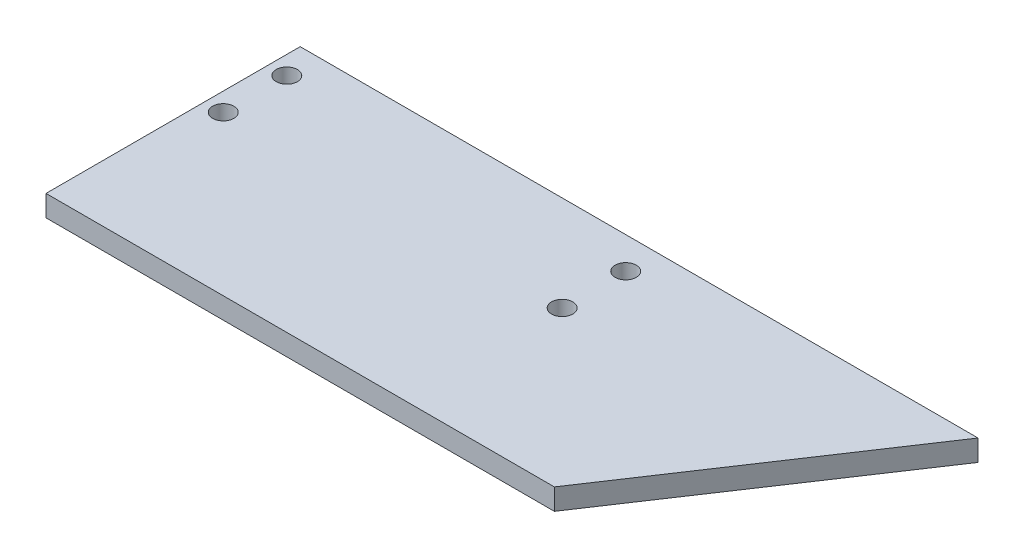
from build123d import *

# Parameters (mm, degrees)
SKETCH1_R           = 3.175
BOSS_EXTRUDE1_DEPTH = 6.35


with BuildPart() as part:
    # Sketch1 → Boss-Extrude1 (new body)
    with BuildSketch(Plane(origin=(0, 0, 0), x_dir=(1, 0, 0), z_dir=(0, 1, 0))):
        Polygon((116.114285714, 43.542857143), (65.314285714, -32.657142857), (-87.085714286, -32.657142857), (-87.085714286, 43.542857143), align=None)
        with Locations((20.025058571, 34.017857143)):
            Circle(SKETCH1_R, mode=Mode.SUBTRACT)
        with Locations((20.025058571, 14.967857143)):
            Circle(SKETCH1_R, mode=Mode.SUBTRACT)
        with Locations((-81.574941429, 34.017857143)):
            Circle(SKETCH1_R, mode=Mode.SUBTRACT)
        with Locations((-81.574941429, 14.967857143)):
            Circle(SKETCH1_R, mode=Mode.SUBTRACT)
    extrude(amount=BOSS_EXTRUDE1_DEPTH)


solid = part.part
